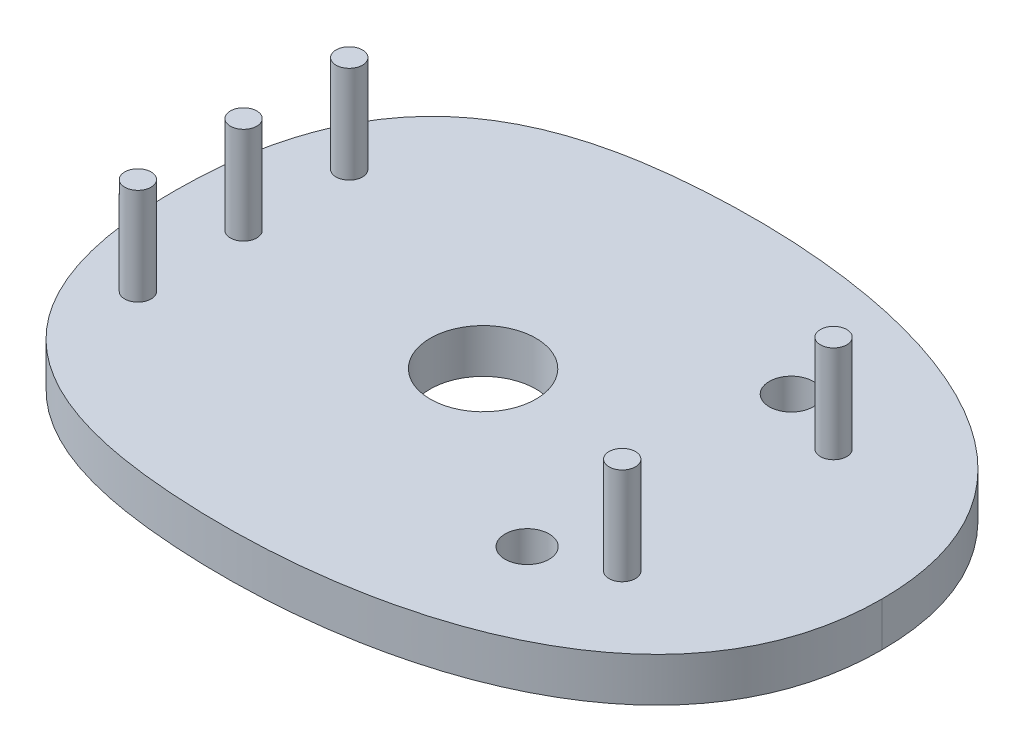
from build123d import *

# Parameters (mm, degrees)
BOSS_EXTRUDE5_DEPTH = 5
SKETCH13_R          = 6
SKETCH13_R_2        = 2.5
CUT_EXTRUDE2_DEPTH  = 5
SKETCH14_R          = 1.5
BOSS_EXTRUDE7_DEPTH = 11
SKETCH23_R          = 0.5
CUT_EXTRUDE4_DEPTH  = 26


with BuildPart() as part:
    # Boss-Extrude5: read off the stored shape, not the designer's step
    # Boss-Extrude5 outline → Boss-Extrude5 (new body)
    with BuildSketch(Plane(origin=(0, 0, 0), x_dir=(1, 0, 0), z_dir=(0, 1, 0))):
        with BuildLine():
            add(Edge.make_bspline(
                [(97.498366587, 0), (97.498366587, 5.494965981), (95.368246981, 12.424648528), (89.437888787, 19.309158713), (83.750209197, 23.374135755), (77.119768761, 26.418925762), (69.847707641, 28.527993254), (60.946744594, 29.995631954), (53.226995966, 30.297134862), (45.826037825, 29.960958507), (39.955515396, 29.307378063), (33.586514188, 27.706977102), (28.028508067, 25.084087708), (23.434402968, 21.240868966), (18.791569993, 14.217010617), (17.2, 6.514008296), (17.2, -6.514008296), (18.791569993, -14.217010617), (23.434402968, -21.240868966), (28.028508067, -25.084087708), (33.586514188, -27.706977102), (39.955515396, -29.307378063), (45.826037825, -29.960958507), (53.226995966, -30.297134862), (60.946744594, -29.995631954), (69.847707641, -28.527993254), (77.119768761, -26.418925762), (83.750209197, -23.374135755), (89.437888787, -19.309158713), (95.368246981, -12.424648528), (97.498366587, -5.494965981), (97.498366587, 0)],
                knots=[0, 0, 0, 0, 0.125, 0.1875, 0.25, 0.3125, 0.375, 0.4375, 0.53125, 0.5625, 0.625, 0.6875, 0.75, 0.8125, 0.875, 1, 1, 1.125, 1.1875, 1.25, 1.3125, 1.375, 1.4375, 1.46875, 1.5625, 1.625, 1.6875, 1.75, 1.8125, 1.875, 2, 2, 2, 2], degree=3))
        make_face()
    extrude(amount=BOSS_EXTRUDE5_DEPTH)

    # Sketch13 → Cut-Extrude2 (cut)
    with BuildSketch(Plane(origin=(0, 0, 0), x_dir=(1, 0, 0), z_dir=(0, 1, 0))):
        with Locations(Location((52.2, 0, 0), (0, 0, 270))):
            Circle(SKETCH13_R)
        with Locations(Location((72.2, 15, 0), (0, 0, 270))):
            Circle(SKETCH13_R_2)
        with Locations(Location((72.2, -15, 0), (0, 0, 270))):
            Circle(SKETCH13_R_2)
    extrude(amount=CUT_EXTRUDE2_DEPTH, mode=Mode.SUBTRACT)

    # Sketch14 → Boss-Extrude7 (add)
    with BuildSketch(Plane(origin=(0, 5, 0), x_dir=(1, 0, 0), z_dir=(0, 1, 0))):
        with Locations(Location((80, 12, 0), (0, 0, 90))):
            Circle(SKETCH14_R)
        with Locations(Location((80, -12, 0), (0, 0, 90))):
            Circle(SKETCH14_R)
        with Locations(Location((25, 12, 0), (0, 0, 90))):
            Circle(SKETCH14_R)
        with Locations(Location((25, -12, 0), (0, 0, 90))):
            Circle(SKETCH14_R)
        with Locations(Location((25, 0, 0), (0, 0, 90))):
            Circle(SKETCH14_R)
    extrude(amount=BOSS_EXTRUDE7_DEPTH)

    # Sketch23 → Cut-Extrude4 (cut)
    with BuildSketch(Plane(origin=(0, 0, 0), x_dir=(0, 0, -1), z_dir=(1, 0, 0))):
        with Locations(Location((0, 7, 0), (0, 0, 180))):
            Circle(SKETCH23_R)
    extrude(amount=CUT_EXTRUDE4_DEPTH, mode=Mode.SUBTRACT)


solid = part.part
